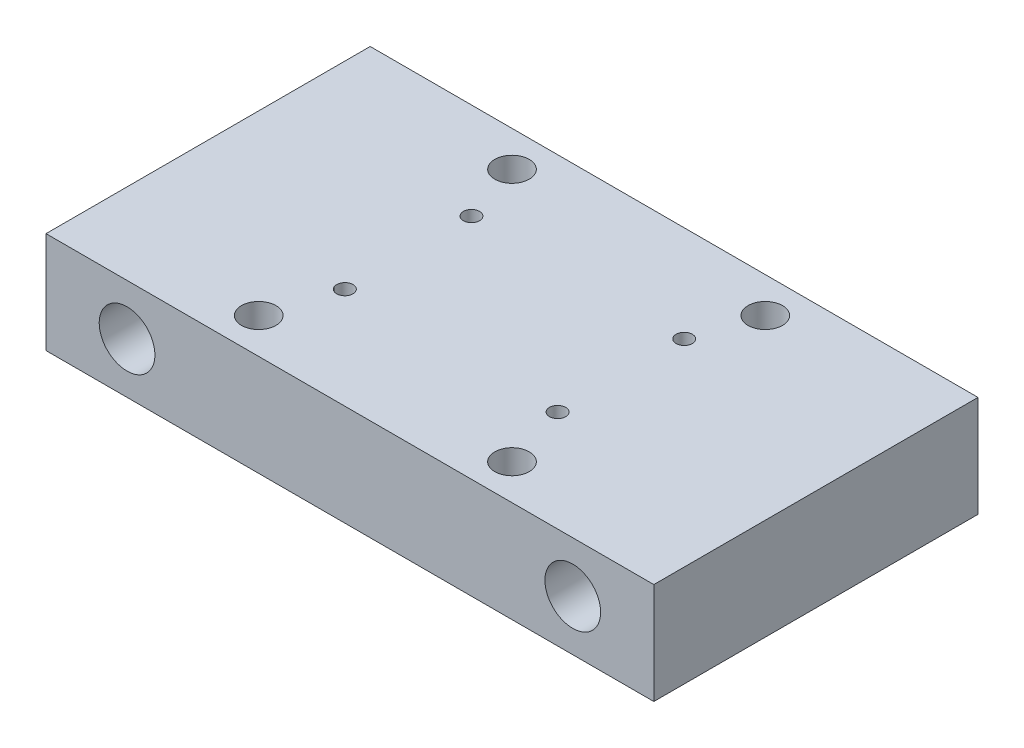
from build123d import *

# Parameters (mm, degrees)
SKETCH2_W                      = 60
SKETCH2_H                      = 32
BOSS_EXTRUDE1_DEPTH            = 10
CBORE_FOR_M3_SHCS1_D           = 3.4
CBORE_FOR_M3_SHCS1_CBORE_D     = 6.5
CBORE_FOR_M3_SHCS1_CBORE_DEPTH = 5
SKETCH6_W                      = 17
SKETCH6_H                      = 12
CUT_EXTRUDE2_DEPTH             = 2
CUT_EXTRUDE4_DEPTH             = 5
M5_CLEARANCE_HOLE1_D           = 5.5
SKETCH12_R                     = 2
BOSS_EXTRUDE2_DEPTH            = 2.5
M2X0_4_TAPPED_HOLE1_D          = 1.6


with BuildPart() as part:
    # Sketch2 → Boss-Extrude1 (new body)
    with BuildSketch(Plane(origin=(0, 0, 0), x_dir=(1, 0, 0), z_dir=(0, 1, 0))):
        Rectangle(SKETCH2_W, SKETCH2_H)
    extrude(amount=BOSS_EXTRUDE1_DEPTH)

    # CBORE for M3 SHCS1 (through all)
    with Locations(Plane(origin=(0, 0, 0), x_dir=(-1, 0, 0), z_dir=(0, -1, 0))):
        with Locations((12.5, 12.5), (12.5, -12.5), (-12.5, -12.5), (-12.5, 12.5)):
            CounterBoreHole(CBORE_FOR_M3_SHCS1_D / 2, CBORE_FOR_M3_SHCS1_CBORE_D / 2, CBORE_FOR_M3_SHCS1_CBORE_DEPTH)

    # Sketch6 → Cut-Extrude2 (cut)
    with BuildSketch(Plane(origin=(0, 0, 0), x_dir=(-1, 0, 0), z_dir=(0, -1, 0))):
        with Locations((0, 10)):
            Rectangle(SKETCH6_W, SKETCH6_H)
    extrude(amount=-CUT_EXTRUDE2_DEPTH, mode=Mode.SUBTRACT)

    # Sketch8 → Cut-Extrude4 (cut)
    with BuildSketch(Plane(origin=(0, 0, -16), x_dir=(-1, 0, 0), z_dir=(0, 0, -1))):
        Polygon((17.265727793, 5), (19.632863896, 0.9), (24.367136104, 0.9), (26.734272207, 5), (24.367136104, 9.1), (19.632863896, 9.1), align=None)
        Polygon((-17.265727793, 5), (-19.632863896, 9.1), (-24.367136104, 9.1), (-26.734272207, 5), (-24.367136104, 0.9), (-19.632863896, 0.9), align=None)
    extrude(amount=-CUT_EXTRUDE4_DEPTH, mode=Mode.SUBTRACT)

    # M5 Clearance Hole1 (through all)
    with Locations(Plane(origin=(0, 0, -11), x_dir=(-1, 0, 0), z_dir=(0, 0, -1))):
        with Locations((22, 5), (-22, 5)):
            Hole(M5_CLEARANCE_HOLE1_D / 2)

    # Sketch12 → Boss-Extrude2 (add)
    with BuildSketch(Plane.XZ):
        with Locations((10.5, -6.5)):
            Circle(SKETCH12_R)
        with Locations((-10.5, -6.5)):
            Circle(SKETCH12_R)
        with Locations((10.5, 6)):
            Circle(SKETCH12_R)
        with Locations((-10.5, 6)):
            Circle(SKETCH12_R)
    extrude(amount=BOSS_EXTRUDE2_DEPTH)

    # M2x0.4 Tapped Hole1 (through all)
    with Locations(Plane(origin=(0, -2.5, 0), x_dir=(-1, 0, 0), z_dir=(0, -1, 0))):
        with Locations((-10.5, -6), (-10.5, 6.5), (10.5, -6), (10.5, 6.5)):
            Hole(M2X0_4_TAPPED_HOLE1_D / 2)


solid = part.part
